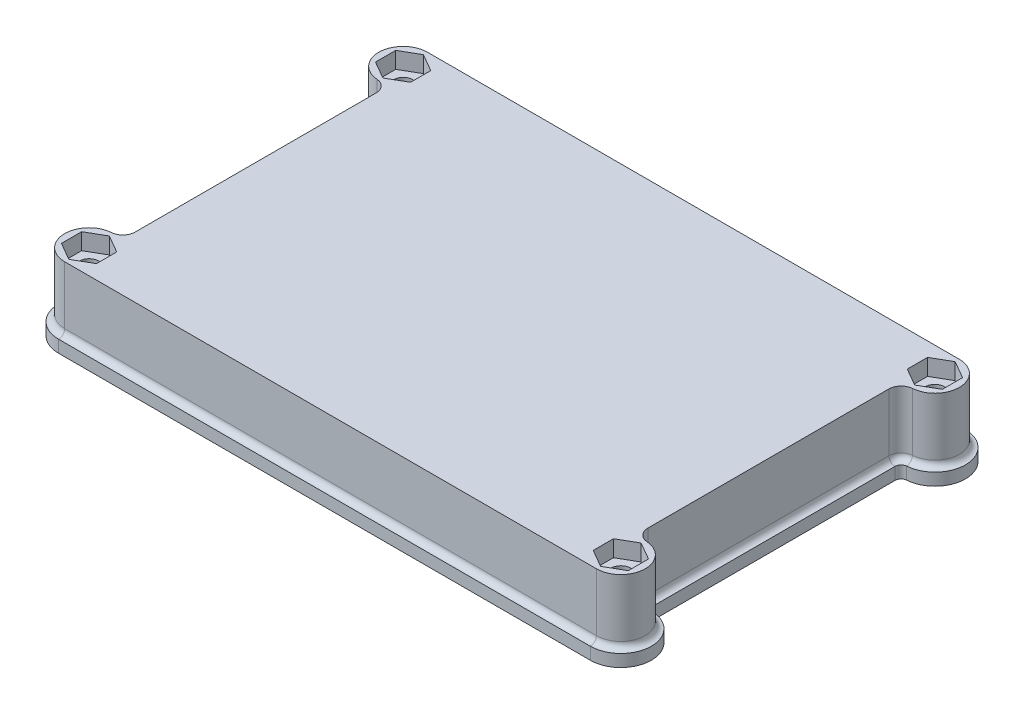
from build123d import *

# Parameters (mm, degrees)
SKETCH_1_R            = 1.6
EXTRUDE_1_DEPTH       = 9.5
SKETCH_2_R            = 1.6
EXTRUDE_2_DEPTH       = 2
CUT_EXTRUDE_1_DEPTH   = 2.7
EXTRUDE_1_2_DEPTH     = 0.5
EXTRUDE_2_2_DEPTH     = 1
FILLET_1_R            = 1
CUT_EXTRUDE_1_2_REACH = 61.309
SKETCH_8_R            = 3
SKETCH_8_W            = 5
SKETCH_8_H            = 5
CUT_EXTRUDE_2_DEPTH   = 1.5
EXTRUDE_START         = 2
SKETCH_10_R           = 3
SKETCH_10_R_2         = 2
SKETCH_10_W           = 5
SKETCH_10_H           = 5
SKETCH_10_W_2         = 4
SKETCH_10_H_2         = 4
EXTRUDE_3_DEPTH       = 2


with BuildPart() as part:
    # Эскиз1 → Extrude 1 (new body)
    with BuildSketch(Plane(origin=(0, 0, 0), x_dir=(1, 0, 0), z_dir=(0, 1, 0))):
        with BuildLine():
            Line((-42.830174167, 19.765888806), (-42.830174167, -19.765888806))
            ThreePointArc((-42.830174167, -19.765888806), (-43.365437144, -21.127705775), (-44.684719621, -21.760592538))
            ThreePointArc((-44.684719621, -21.760592538), (-48.391161519, -25.895550937), (-44.39381053, -29.75))
            Line((-44.39381053, -29.75), (42.80618947, -29.75))
            ThreePointArc((42.80618947, -29.75), (46.803540458, -25.895550937), (43.097098561, -21.760592538))
            ThreePointArc((43.097098561, -21.760592538), (41.777816084, -21.127705775), (41.242553106, -19.765888806))
            Line((41.242553106, -19.765888806), (41.242553106, 19.765888806))
            ThreePointArc((41.242553106, 19.765888806), (41.777816084, 21.127705775), (43.097098561, 21.760592538))
            ThreePointArc((43.097098561, 21.760592538), (46.803540458, 25.895550937), (42.80618947, 29.75))
            Line((42.80618947, 29.75), (-44.39381053, 29.75))
            ThreePointArc((-44.39381053, 29.75), (-48.391161519, 25.895550937), (-44.684719621, 21.760592538))
            ThreePointArc((-44.684719621, 21.760592538), (-43.365437144, 21.127705775), (-42.830174167, 19.765888806))
        make_face()
        with Locations(Location((-44.39381053, -25.75, 0), (0, 0, 270))):
            Circle(SKETCH_1_R, mode=Mode.SUBTRACT)
        with Locations(Location((-44.39381053, 25.75, 0), (0, 0, 270))):
            Circle(SKETCH_1_R, mode=Mode.SUBTRACT)
        with Locations(Location((42.80618947, 25.75, 0), (0, 0, 270))):
            Circle(SKETCH_1_R, mode=Mode.SUBTRACT)
        with Locations(Location((42.80618947, -25.75, 0), (0, 0, 270))):
            Circle(SKETCH_1_R, mode=Mode.SUBTRACT)
        with BuildLine():
            Line((38.242553106, -23.75), (38.242553106, 23.75))
            ThreePointArc((38.242553106, 23.75), (37.36387345, 25.871320344), (35.242553106, 26.75))
            Line((35.242553106, 26.75), (-36.830174167, 26.75))
            ThreePointArc((-36.830174167, 26.75), (-38.95149451, 25.871320344), (-39.830174167, 23.75))
            Line((-39.830174167, 23.75), (-39.830174167, -23.75))
            ThreePointArc((-39.830174167, -23.75), (-38.95149451, -25.871320344), (-36.830174167, -26.75))
            Line((-36.830174167, -26.75), (35.242553106, -26.75))
            ThreePointArc((35.242553106, -26.75), (37.36387345, -25.871320344), (38.242553106, -23.75))
        make_face(mode=Mode.SUBTRACT)
    extrude(amount=EXTRUDE_1_DEPTH)

    # Эскиз2 → Extrude 2 (add)
    with BuildSketch(Plane(origin=(0, 9.5, 0), x_dir=(1, 0, 0), z_dir=(0, 1, 0))):
        with BuildLine():
            Line((41.242553106, 19.765888806), (41.242553106, -19.765888806))
            ThreePointArc((41.242553106, -19.765888806), (41.777816084, -21.127705775), (43.097098561, -21.760592538))
            ThreePointArc((43.097098561, -21.760592538), (46.803540458, -25.895550937), (42.80618947, -29.75))
            Line((42.80618947, -29.75), (-44.39381053, -29.75))
            ThreePointArc((-44.39381053, -29.75), (-48.391161519, -25.895550937), (-44.684719621, -21.760592538))
            ThreePointArc((-44.684719621, -21.760592538), (-43.365437144, -21.127705775), (-42.830174167, -19.765888806))
            Line((-42.830174167, -19.765888806), (-42.830174167, 19.765888806))
            ThreePointArc((-42.830174167, 19.765888806), (-43.365437144, 21.127705775), (-44.684719621, 21.760592538))
            ThreePointArc((-44.684719621, 21.760592538), (-48.391161519, 25.895550937), (-44.39381053, 29.75))
            Line((-44.39381053, 29.75), (42.80618947, 29.75))
            ThreePointArc((42.80618947, 29.75), (46.803540458, 25.895550937), (43.097098561, 21.760592538))
            ThreePointArc((43.097098561, 21.760592538), (41.777816084, 21.127705775), (41.242553106, 19.765888806))
        make_face()
        with Locations(Location((42.80618947, 25.75, 0), (0, 0, 270))):
            Circle(SKETCH_2_R, mode=Mode.SUBTRACT)
        with Locations(Location((42.80618947, -25.75, 0), (0, 0, 270))):
            Circle(SKETCH_2_R, mode=Mode.SUBTRACT)
        with Locations(Location((-44.39381053, -25.75, 0), (0, 0, 270))):
            Circle(SKETCH_2_R, mode=Mode.SUBTRACT)
        with Locations(Location((-44.39381053, 25.75, 0), (0, 0, 270))):
            Circle(SKETCH_2_R, mode=Mode.SUBTRACT)
    extrude(amount=EXTRUDE_2_DEPTH)

    # Эскиз3 → Cut-Extrude 1 (cut)
    with BuildSketch(Plane(origin=(0, 11.5, 0), x_dir=(1, 0, 0), z_dir=(0, 1, 0))):
        Polygon((-44.39381053, 22.430235952), (-41.51881053, 24.090117976), (-41.51881053, 27.409882024), (-44.39381053, 29.069764048), (-47.26881053, 27.409882024), (-47.26881053, 24.090117976), align=None)
        Polygon((45.68118947, 24.090117976), (42.80618947, 22.430235952), (39.93118947, 24.090117976), (39.93118947, 27.409882024), (42.80618947, 29.069764048), (45.68118947, 27.409882024), align=None)
        Polygon((42.80618947, -22.430235952), (39.93118947, -24.090117976), (39.93118947, -27.409882024), (42.80618947, -29.069764048), (45.68118947, -27.409882024), (45.68118947, -24.090117976), align=None)
        Polygon((-47.26881053, -24.090117976), (-44.39381053, -22.430235952), (-41.51881053, -24.090117976), (-41.51881053, -27.409882024), (-44.39381053, -29.069764048), (-47.26881053, -27.409882024), align=None)
    extrude(amount=-CUT_EXTRUDE_1_DEPTH, mode=Mode.SUBTRACT)

    # Эскиз4 → Extrude 1 2 (add)
    with BuildSketch(Plane.XZ):
        with BuildLine():
            Line((-38.330174167, 28.75), (36.742553106, 28.75))
            ThreePointArc((36.742553106, 28.75), (39.21742684, 27.724873734), (40.242553106, 25.25))
            Line((40.242553106, 25.25), (40.242553106, -25.25))
            ThreePointArc((40.242553106, -25.25), (39.21742684, -27.724873734), (36.742553106, -28.75))
            Line((36.742553106, -28.75), (-38.330174167, -28.75))
            ThreePointArc((-38.330174167, -28.75), (-40.805047901, -27.724873734), (-41.830174167, -25.25))
            Line((-41.830174167, -25.25), (-41.830174167, 25.25))
            ThreePointArc((-41.830174167, 25.25), (-40.805047901, 27.724873734), (-38.330174167, 28.75))
        make_face()
        with BuildLine():
            Line((-38.330174167, 27.75), (36.742553106, 27.75))
            ThreePointArc((36.742553106, 27.75), (38.510320059, 27.017766953), (39.242553106, 25.25))
            Line((39.242553106, 25.25), (39.242553106, -25.25))
            ThreePointArc((39.242553106, -25.25), (38.510320059, -27.017766953), (36.742553106, -27.75))
            Line((36.742553106, -27.75), (-38.330174167, -27.75))
            ThreePointArc((-38.330174167, -27.75), (-40.09794112, -27.017766953), (-40.830174167, -25.25))
            Line((-40.830174167, -25.25), (-40.830174167, 25.25))
            ThreePointArc((-40.830174167, 25.25), (-40.09794112, 27.017766953), (-38.330174167, 27.75))
        make_face(mode=Mode.SUBTRACT)
    extrude(amount=EXTRUDE_1_2_DEPTH)

    # Эскиз5 → Extrude 2 2 (add, symmetric)
    with BuildSketch(Plane.XZ):
        with BuildLine():
            ThreePointArc((43.169825833, 20.763240672), (42.510184595, 20.44679729), (42.242553106, 19.765888806))
            Line((42.242553106, 19.765888806), (42.242553106, -19.765888806))
            ThreePointArc((42.242553106, -19.765888806), (42.510184595, -20.44679729), (43.169825833, -20.763240672))
            ThreePointArc((43.169825833, -20.763240672), (47.802878205, -25.931938671), (42.80618947, -30.75))
            Line((42.80618947, -30.75), (-44.39381053, -30.75))
            ThreePointArc((-44.39381053, -30.75), (-49.390499266, -25.931938671), (-44.757446894, -20.763240672))
            ThreePointArc((-44.757446894, -20.763240672), (-44.097805655, -20.44679729), (-43.830174167, -19.765888806))
            Line((-43.830174167, -19.765888806), (-43.830174167, 19.765888806))
            ThreePointArc((-43.830174167, 19.765888806), (-44.097805655, 20.44679729), (-44.757446894, 20.763240672))
            ThreePointArc((-44.757446894, 20.763240672), (-49.390499266, 25.931938671), (-44.39381053, 30.75))
            Line((-44.39381053, 30.75), (42.80618947, 30.75))
            ThreePointArc((42.80618947, 30.75), (47.802878205, 25.931938671), (43.169825833, 20.763240672))
        make_face()
        with BuildLine():
            ThreePointArc((43.097098561, 21.760592538), (41.777816084, 21.127705775), (41.242553106, 19.765888806))
            Line((41.242553106, 19.765888806), (41.242553106, -19.765888806))
            ThreePointArc((41.242553106, -19.765888806), (41.777816084, -21.127705775), (43.097098561, -21.760592538))
            ThreePointArc((43.097098561, -21.760592538), (46.803540458, -25.895550937), (42.80618947, -29.75))
            Line((42.80618947, -29.75), (-44.39381053, -29.75))
            ThreePointArc((-44.39381053, -29.75), (-48.391161519, -25.895550937), (-44.684719621, -21.760592538))
            ThreePointArc((-44.684719621, -21.760592538), (-43.365437144, -21.127705775), (-42.830174167, -19.765888806))
            Line((-42.830174167, -19.765888806), (-42.830174167, 19.765888806))
            ThreePointArc((-42.830174167, 19.765888806), (-43.365437144, 21.127705775), (-44.684719621, 21.760592538))
            ThreePointArc((-44.684719621, 21.760592538), (-48.391161519, 25.895550937), (-44.39381053, 29.75))
            Line((-44.39381053, 29.75), (42.80618947, 29.75))
            ThreePointArc((42.80618947, 29.75), (46.803540458, 25.895550937), (43.097098561, 21.760592538))
        make_face(mode=Mode.SUBTRACT)
    extrude(amount=EXTRUDE_2_2_DEPTH, both=True)

    # Скругление1
    fillet_1_edges = [part.edges().sort_by_distance(p)[0] for p in [
        (41.777816084, 1, -21.127705775),
        (41.242553106, 1, 0),
        (41.777816084, 1, 21.127705775),
        (46.803540458, 1, 25.895550937),
        (-0.79381053, 1, 29.75),
        (-48.391161519, 1, 25.895550937),
        (-43.365437144, 1, 21.127705775),
        (-42.830174167, 1, 0),
        (-43.365437144, 1, -21.127705775),
        (-48.391161519, 1, -25.895550937),
        (-0.79381053, 1, -29.75),
        (46.803540458, 1, -25.895550937),
    ]]
    fillet(fillet_1_edges, radius=FILLET_1_R - 0.0001)  # a hair under: the kernel refuses the full size

    # Эскиз6 → Cut-Extrude 1 2 (cut, up to next)
    with BuildSketch(Plane.XZ, mode=Mode.PRIVATE) as cut_extrude_1_2_sk1:
        with BuildLine():
            Line((42.80618947, 29.9), (-44.39381053, 29.9))
            ThreePointArc((-44.39381053, 29.9), (-48.541062181, 25.901009097), (-44.695628712, 21.610989758))
            ThreePointArc((-44.695628712, 21.610989758), (-43.475292421, 21.025569502), (-42.980174167, 19.765888806))
            Line((-42.980174167, 19.765888806), (-42.980174167, -19.765888806))
            ThreePointArc((-42.980174167, -19.765888806), (-43.475292421, -21.025569502), (-44.695628712, -21.610989758))
            ThreePointArc((-44.695628712, -21.610989758), (-48.541062181, -25.901009097), (-44.39381053, -29.9))
            Line((-44.39381053, -29.9), (42.80618947, -29.9))
            ThreePointArc((42.80618947, -29.9), (46.95344112, -25.901009097), (43.108007652, -21.610989758))
            ThreePointArc((43.108007652, -21.610989758), (41.88767136, -21.025569502), (41.392553106, -19.765888806))
            Line((41.392553106, -19.765888806), (41.392553106, 19.765888806))
            ThreePointArc((41.392553106, 19.765888806), (41.88767136, 21.025569502), (43.108007652, 21.610989758))
            ThreePointArc((43.108007652, 21.610989758), (46.95344112, 25.901009097), (42.80618947, 29.9))
        make_face()
        with BuildLine():
            Line((42.80618947, 29.75), (-44.39381053, 29.75))
            ThreePointArc((-44.39381053, 29.75), (-48.391161519, 25.895550937), (-44.684719621, 21.760592538))
            ThreePointArc((-44.684719621, 21.760592538), (-43.365437144, 21.127705775), (-42.830174167, 19.765888806))
            Line((-42.830174167, 19.765888806), (-42.830174167, -19.765888806))
            ThreePointArc((-42.830174167, -19.765888806), (-43.365437144, -21.127705775), (-44.684719621, -21.760592538))
            ThreePointArc((-44.684719621, -21.760592538), (-48.391161519, -25.895550937), (-44.39381053, -29.75))
            Line((-44.39381053, -29.75), (42.80618947, -29.75))
            ThreePointArc((42.80618947, -29.75), (46.803540458, -25.895550937), (43.097098561, -21.760592538))
            ThreePointArc((43.097098561, -21.760592538), (41.777816084, -21.127705775), (41.242553106, -19.765888806))
            Line((41.242553106, -19.765888806), (41.242553106, 19.765888806))
            ThreePointArc((41.242553106, 19.765888806), (41.777816084, 21.127705775), (43.097098561, 21.760592538))
            ThreePointArc((43.097098561, 21.760592538), (46.803540458, 25.895550937), (42.80618947, 29.75))
        make_face(mode=Mode.SUBTRACT)
    cut_extrude_1_2_tool1 = extrude(cut_extrude_1_2_sk1.sketch, amount=CUT_EXTRUDE_1_2_REACH, mode=Mode.PRIVATE) & part.part
    add(cut_extrude_1_2_tool1.solids().sort_by_distance((41.80515, 0, 21.102293))[0], mode=Mode.SUBTRACT)

    # Эскиз8 → Вырез-Вытянуть2 (cut)
    # profile 1 of 2: a face of its own
    with BuildSketch(Plane.XZ.offset(-9.5)):
        with BuildLine():
            Line((-36.730174167, 2.75), (-23.730174167, 2.75))
            ThreePointArc((-23.730174167, 2.75), (-21.608853823, 1.871320344), (-20.730174167, -0.25))
            Line((-20.730174167, -0.25), (-20.730174167, -13.25))
            ThreePointArc((-20.730174167, -13.25), (-21.608853823, -15.371320344), (-23.730174167, -16.25))
            Line((-23.730174167, -16.25), (-36.730174167, -16.25))
            ThreePointArc((-36.730174167, -16.25), (-38.85149451, -15.371320344), (-39.730174167, -13.25))
            Line((-39.730174167, -13.25), (-39.730174167, -0.25))
            ThreePointArc((-39.730174167, -0.25), (-38.85149451, 1.871320344), (-36.730174167, 2.75))
        make_face()
        with Locations(Location((-30.230174167, -6.75, 0), (0, 0, 270))):
            Circle(SKETCH_8_R, mode=Mode.SUBTRACT)
    # profile 2 of 2: a face of its own
    with BuildSketch(Plane.XZ.offset(-9.5)):
        with BuildLine():
            Line((22.142553106, 2.75), (35.142553106, 2.75))
            ThreePointArc((35.142553106, 2.75), (37.26387345, 1.871320344), (38.142553106, -0.25))
            Line((38.142553106, -0.25), (38.142553106, -13.25))
            ThreePointArc((38.142553106, -13.25), (37.26387345, -15.371320344), (35.142553106, -16.25))
            Line((35.142553106, -16.25), (22.142553106, -16.25))
            ThreePointArc((22.142553106, -16.25), (20.021232763, -15.371320344), (19.142553106, -13.25))
            Line((19.142553106, -13.25), (19.142553106, -0.25))
            ThreePointArc((19.142553106, -0.25), (20.021232763, 1.871320344), (22.142553106, 2.75))
        make_face()
        with Locations((28.642553106, -6.75)):
            Rectangle(SKETCH_8_W, SKETCH_8_H, mode=Mode.SUBTRACT)
    extrude(amount=-CUT_EXTRUDE_2_DEPTH, mode=Mode.SUBTRACT)

    # Эскиз10 → Бобышка-Вытянуть3 (add)
    # profile 1 of 2: a face of its own
    with BuildSketch(Plane.XZ.offset(-9.5).offset(EXTRUDE_START)):
        with Locations(Location((-30.230174167, -6.75, 0), (0, 0, 270))):
            Circle(SKETCH_10_R)
        with Locations(Location((-30.230174167, -6.75, 0), (0, 0, 270))):
            Circle(SKETCH_10_R_2, mode=Mode.SUBTRACT)
    # profile 2 of 2: a face of its own
    with BuildSketch(Plane.XZ.offset(-9.5).offset(EXTRUDE_START)):
        with Locations((28.642553106, -6.75)):
            Rectangle(SKETCH_10_W, SKETCH_10_H)
        with Locations((28.642553106, -6.75)):
            Rectangle(SKETCH_10_W_2, SKETCH_10_H_2, mode=Mode.SUBTRACT)
    extrude(amount=-EXTRUDE_3_DEPTH)


solid = part.part
